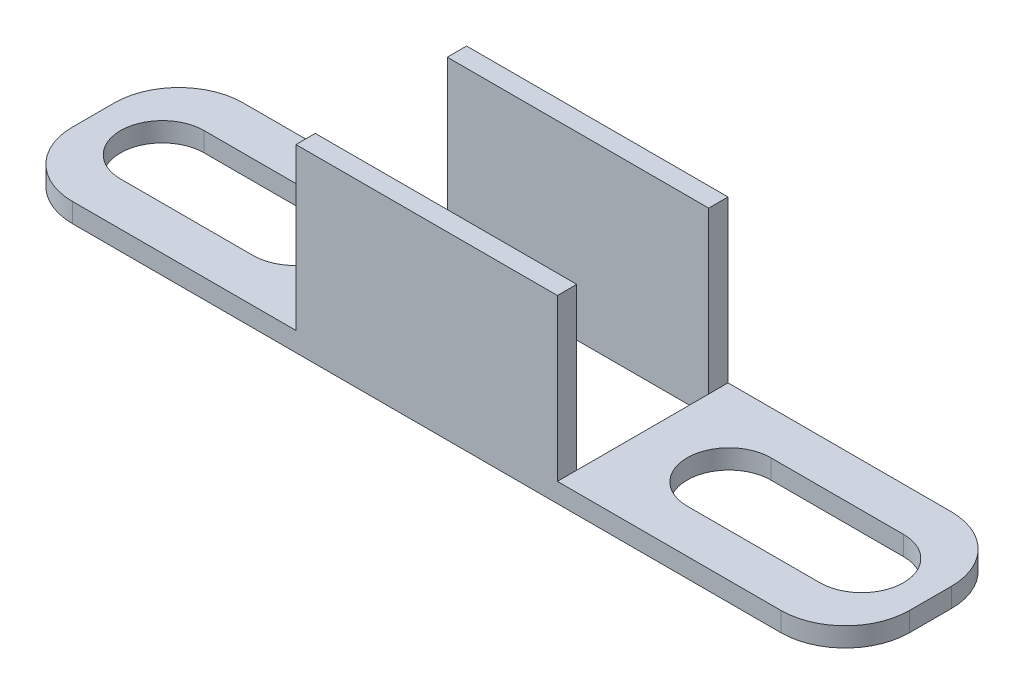
from build123d import *

# Parameters (mm, degrees)
SKETCH1_W           = 130
SKETCH1_H           = 26.5
SKETCH1_W_2         = 40.6
SKETCH1_H_2         = 20.5
BOSS_EXTRUDE1_DEPTH = 3
SKETCH2_W           = 40.6
SKETCH2_H           = 3
BOSS_EXTRUDE2_DEPTH = 25
FILLET1_R           = 10


with BuildPart() as part:
    # Sketch1 → Boss-Extrude1 (new body)
    with BuildSketch(Plane(origin=(0, 0, 0), x_dir=(1, 0, 0), z_dir=(0, 1, 0))):
        Rectangle(SKETCH1_W, SKETCH1_H)
        Rectangle(SKETCH1_W_2, SKETCH1_H_2, mode=Mode.SUBTRACT)
        with BuildLine():
            Line((33.7, 6.5), (54.3, 6.5))
            ThreePointArc((54.3, 6.5), (60.8, 0), (54.3, -6.5))
            Line((54.3, -6.5), (33.7, -6.5))
            ThreePointArc((33.7, -6.5), (27.2, 0), (33.7, 6.5))
        make_face(mode=Mode.SUBTRACT)
        with BuildLine():
            Line((-33.7, -6.5), (-54.3, -6.5))
            ThreePointArc((-54.3, -6.5), (-60.8, 0), (-54.3, 6.5))
            Line((-54.3, 6.5), (-33.7, 6.5))
            ThreePointArc((-33.7, 6.5), (-27.2, 0), (-33.7, -6.5))
        make_face(mode=Mode.SUBTRACT)
    extrude(amount=BOSS_EXTRUDE1_DEPTH)

    # Sketch2 → Boss-Extrude2 (add)
    with BuildSketch(Plane(origin=(0, 3, 0), x_dir=(1, 0, 0), z_dir=(0, 1, 0))):
        with Locations((0, -11.75)):
            Rectangle(SKETCH2_W, SKETCH2_H)
        with Locations((0, 11.75)):
            Rectangle(SKETCH2_W, SKETCH2_H)
    extrude(amount=BOSS_EXTRUDE2_DEPTH)

    # Fillet1
    fillet1_edges = [part.edges().sort_by_distance(p)[0] for p in [
        (65, 1.5, -13.25),
        (65, 1.5, 13.25),
        (-65, 1.5, -13.25),
        (-65, 1.5, 13.25),
    ]]
    fillet(fillet1_edges, radius=FILLET1_R)


solid = part.part
